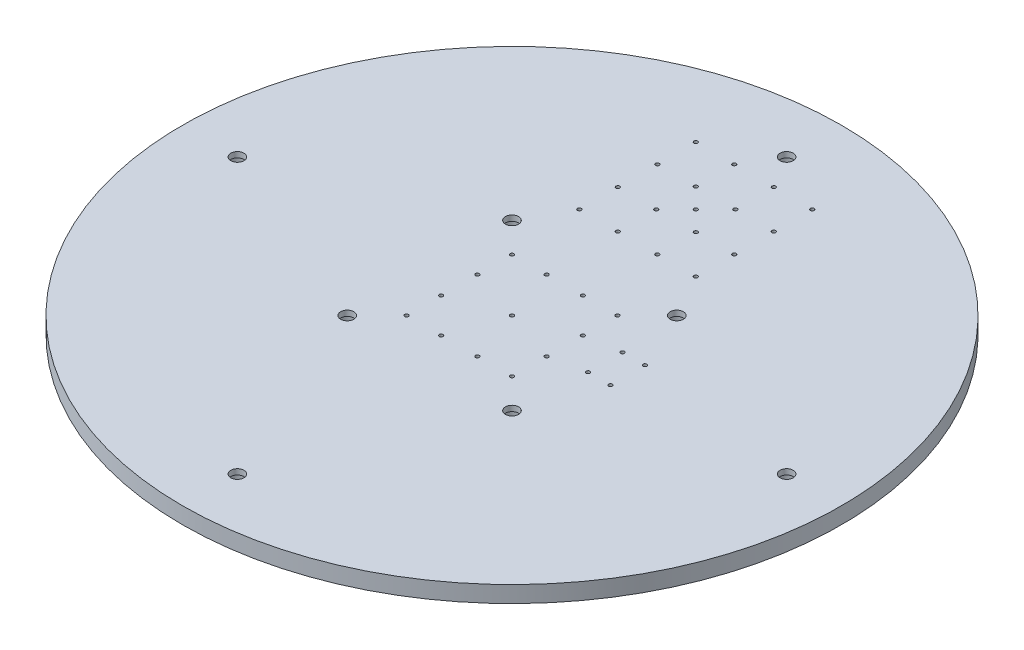
from build123d import *

# Parameters (mm, degrees)
SKETCH1_R                       = 300
BOSS_EXTRUDE1_DEPTH             = 15
CBORE_FOR_M10_SHCS1_D           = 12
CBORE_FOR_M10_SHCS1_CBORE_D     = 18
CBORE_FOR_M10_SHCS1_CBORE_DEPTH = 10
CBORE_FOR_M3_SHCS1_D            = 3.4
CBORE_FOR_M3_SHCS1_CBORE_D      = 6.5
CBORE_FOR_M3_SHCS1_CBORE_DEPTH  = 4
CBORE_FOR_M3_SHCS2_D            = 3.4
CBORE_FOR_M3_SHCS2_CBORE_D      = 6.5
CBORE_FOR_M3_SHCS2_CBORE_DEPTH  = 4


with BuildPart() as part:
    # Sketch1 → Boss-Extrude1 (new body)
    with BuildSketch(Plane(origin=(0, 0, 0), x_dir=(1, 0, 0), z_dir=(0, 1, 0))):
        Circle(SKETCH1_R)
    extrude(amount=BOSS_EXTRUDE1_DEPTH)

    # CBORE for M10 SHCS1 (through all)
    with Locations(Plane.XZ):
        with Locations((75, 75), (0, -250), (250, 0), (0, 250), (-250, 0), (75, -75), (-75, -75), (-75, 75)):
            CounterBoreHole(CBORE_FOR_M10_SHCS1_D / 2, CBORE_FOR_M10_SHCS1_CBORE_D / 2, CBORE_FOR_M10_SHCS1_CBORE_DEPTH)

    # CBORE for M3 SHCS1 (through all)
    with Locations(Plane(origin=(0, 0, 0), x_dir=(-1, 0, 0), z_dir=(0, -1, 0))):
        with Locations((0, 0), (-48, -48), (16.5, -48), (-16.5, -48), (48, -48), (48, -16.5), (48, 16.5), (48, 48), (16.5, 48), (-16.5, 48), (-48, 48), (-79.35, -10.1), (-99.7, -10.1), (-99.7, 21.3), (-79.35, 21.3), (-48, -16.5), (-48, 16.5)):
            CounterBoreHole(CBORE_FOR_M3_SHCS1_D / 2, CBORE_FOR_M3_SHCS1_CBORE_D / 2, CBORE_FOR_M3_SHCS1_CBORE_DEPTH)

    # CBORE for M3 SHCS2 (through all)
    with Locations(Plane(origin=(0, 0, 0), x_dir=(-1, 0, 0), z_dir=(0, -1, 0))):
        with Locations((0, 167.320913922), (53, 114.320913922), (53, 149.320913922), (53, 185.320913922), (53, 220.320913922), (18, 220.320913922), (-18, 220.320913922), (-53, 220.320913922), (-53, 185.320913922), (-53, 149.320913922), (-53, 114.320913922), (-18, 114.320913922), (18, 114.320913922), (18, 149.320913922), (18, 185.320913922), (-18, 149.320913922), (-18, 185.320913922)):
            CounterBoreHole(CBORE_FOR_M3_SHCS2_D / 2, CBORE_FOR_M3_SHCS2_CBORE_D / 2, CBORE_FOR_M3_SHCS2_CBORE_DEPTH)


solid = part.part
